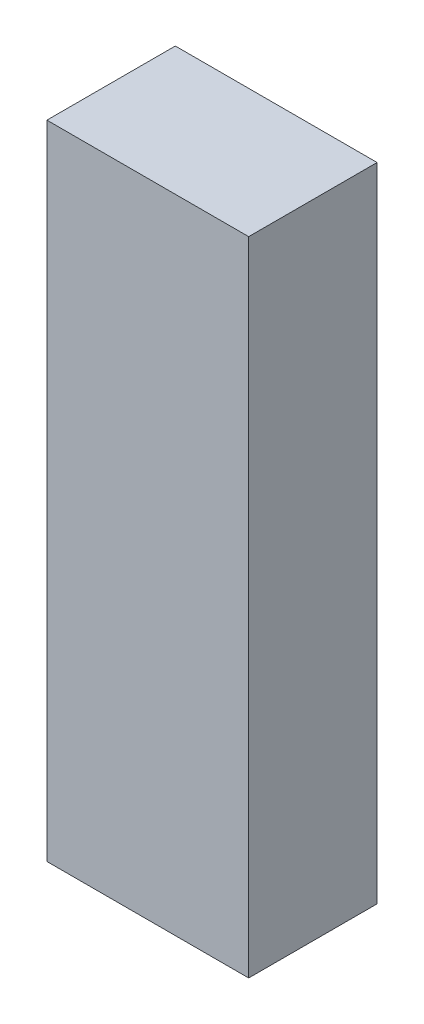
from build123d import *

# Parameters (mm, degrees)
SKETCH1_W           = 33
SKETCH1_H           = 105
BOSS_EXTRUDE1_DEPTH = 21


with BuildPart() as part:
    # Sketch1 → Boss-Extrude1 (new body)
    with BuildSketch(Plane.XY):
        with Locations((16.5, 52.5)):
            Rectangle(SKETCH1_W, SKETCH1_H)
    extrude(amount=BOSS_EXTRUDE1_DEPTH)


solid = part.part
